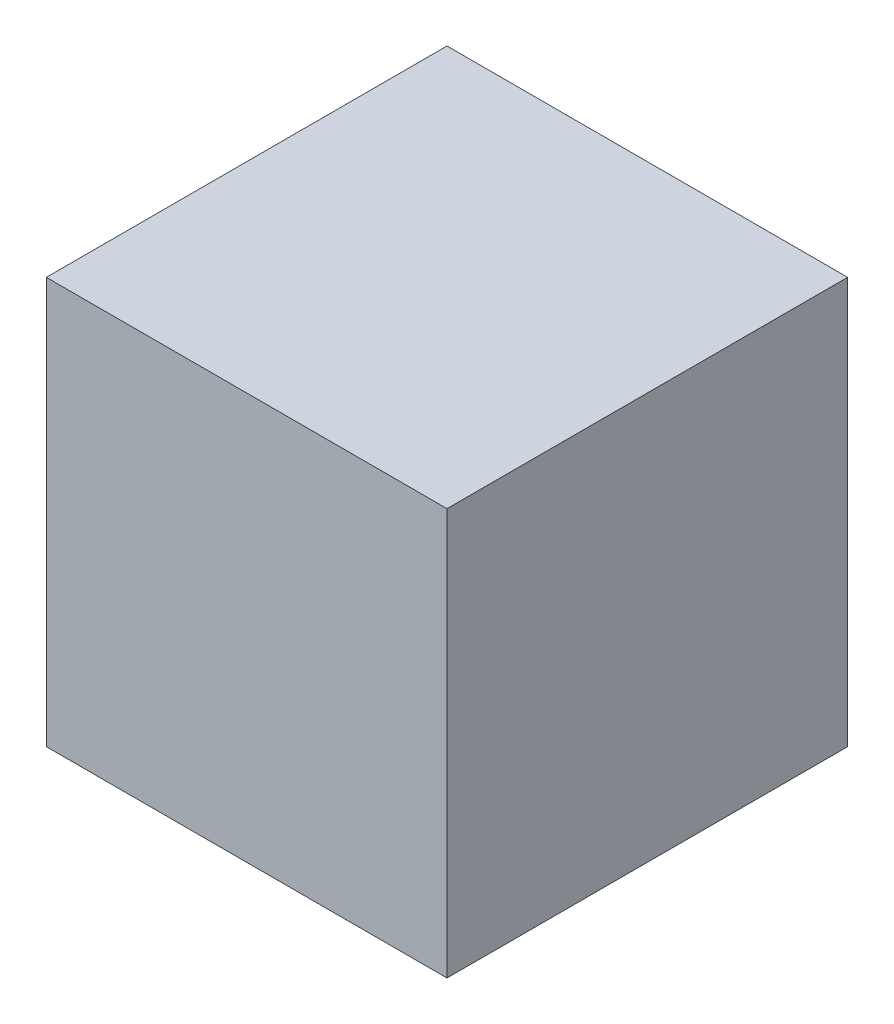
from build123d import *

# Parameters (mm, degrees)
SKETCH1_W           = 6.9
SKETCH1_H           = 6.9
BOSS_EXTRUDE1_DEPTH = 7
SKETCH2_W           = 5
SKETCH2_H           = 4
CUT_EXTRUDE1_DEPTH  = 2


with BuildPart() as part:
    # Sketch1 → Boss-Extrude1 (new body)
    with BuildSketch(Plane(origin=(0, 0, 0), x_dir=(1, 0, 0), z_dir=(0, 1, 0))):
        Rectangle(SKETCH1_W, SKETCH1_H)
    extrude(amount=BOSS_EXTRUDE1_DEPTH)

    # Sketch2 → Cut-Extrude1 (cut)
    with BuildSketch(Plane(origin=(0, 0, -3.45), x_dir=(-1, 0, 0), z_dir=(0, 0, -1))):
        with Locations((0, 4.5)):
            Rectangle(SKETCH2_W, SKETCH2_H)
    extrude(amount=-CUT_EXTRUDE1_DEPTH, mode=Mode.SUBTRACT)


solid = part.part
